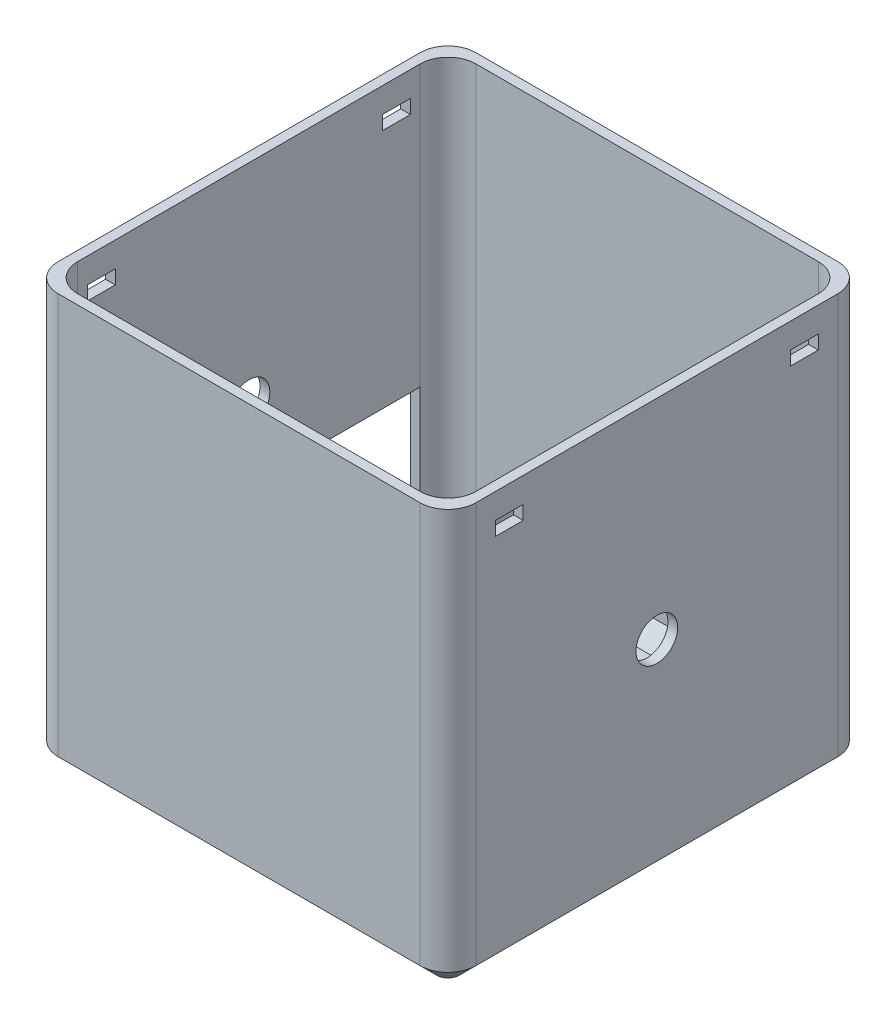
from build123d import *

# Parameters (mm, degrees)
SKETCH1_W           = 150
SKETCH1_H           = 150
BOSS_EXTRUDE1_DEPTH = 150
SHELL1_T            = -3.5
FILLET2_R           = 10
FILLET3_R           = 10
SKETCH2_R           = 7.5
CUT_EXTRUDE1_DEPTH  = 200
CHAMFER1_SIZE       = 6
CHAMFER2_SIZE       = 6
SKETCH3_W           = 10
SKETCH3_H           = 5
CUT_EXTRUDE2_DEPTH  = 234
SKETCH4_W           = 10
SKETCH4_H           = 5
CUT_EXTRUDE3_DEPTH  = 234
SKETCH5_W           = 40
SKETCH5_H           = 40
CUT_EXTRUDE4_DEPTH  = 10
SKETCH6_W           = 4
SKETCH6_H           = 45
BOSS_EXTRUDE2_DEPTH = 40
FILLET4_R           = 10
SKETCH7_W           = 40
SKETCH7_H           = 40
CUT_EXTRUDE5_DEPTH  = 40


with BuildPart() as part:
    # Sketch1 → Boss-Extrude1 (new body)
    with BuildSketch(Plane(origin=(0, 0, 0), x_dir=(1, 0, 0), z_dir=(0, 1, 0))):
        with Locations((75, 75)):
            Rectangle(SKETCH1_W, SKETCH1_H)
    extrude(amount=BOSS_EXTRUDE1_DEPTH)

    # Shell1
    shell1_openings = [part.faces().sort_by_distance(p)[0] for p in [
        (75, 150, -75),
    ]]
    offset(amount=SHELL1_T, openings=shell1_openings, kind=Kind.INTERSECTION)

    # Fillet2
    fillet2_edges = [part.edges().sort_by_distance(p)[0] for p in [
        (150, 75, -150),
        (150, 75, 0),
        (0, 75, 0),
    ]]
    fillet(fillet2_edges, radius=FILLET2_R)

    # Fillet3
    fillet3_edges = [part.edges().sort_by_distance(p)[0] for p in [
        (3.5, 76.75, -146.5),
        (3.5, 76.75, -3.5),
        (146.5, 76.75, -3.5),
        (146.5, 76.75, -146.5),
        (0, 75, -150),
    ]]
    fillet(fillet3_edges, radius=FILLET3_R)

    # Sketch2 → Cut-Extrude1 (cut)
    with BuildSketch(Plane(origin=(150, 0, 0), x_dir=(0, 0, -1), z_dir=(1, 0, 0))):
        with Locations((75, 75)):
            Circle(SKETCH2_R)
    extrude(amount=-CUT_EXTRUDE1_DEPTH, mode=Mode.SUBTRACT)

    # Chamfer1
    chamfer1_edges = [part.edges().sort_by_distance(p)[0] for p in [
        (75, 0, -150),
        (150, 0, -75),
        (75, 0, 0),
        (2.928932188, 0, -2.928932188),
        (147.071067812, 0, -2.928932188),
        (147.071067812, 0, -147.071067812),
        (0, 0, -75),
        (2.928932188, 0, -147.071067812),
    ]]
    chamfer(chamfer1_edges, length=CHAMFER1_SIZE)

    # Chamfer2
    chamfer2_edges = [part.edges().sort_by_distance(p)[0] for p in [
        (3.5, 3.5, -75),
        (75, 3.5, -3.5),
        (146.5, 3.5, -75),
        (75, 3.5, -146.5),
        (6.428932188, 3.5, -143.571067812),
        (143.571067812, 3.5, -143.571067812),
        (143.571067812, 3.5, -6.428932188),
        (6.428932188, 3.5, -6.428932188),
    ]]
    chamfer(chamfer2_edges, length=CHAMFER2_SIZE)

    # Sketch3 → Cut-Extrude2 (cut)
    with BuildSketch(Plane.ZY):
        with Locations((-128, 138.5)):
            Rectangle(SKETCH3_W, SKETCH3_H)
    extrude(amount=-CUT_EXTRUDE2_DEPTH, mode=Mode.SUBTRACT)

    # Sketch4 → Cut-Extrude3 (cut)
    with BuildSketch(Plane.ZY):
        with Locations((-22, 138.5)):
            Rectangle(SKETCH4_W, SKETCH4_H)
    extrude(amount=-CUT_EXTRUDE3_DEPTH, mode=Mode.SUBTRACT)

    # Sketch5 → Cut-Extrude4 (cut)
    with BuildSketch(Plane(origin=(0, 3.5, 0), x_dir=(1, 0, 0), z_dir=(0, 1, 0))):
        with Locations((120.5, 120.5)):
            Rectangle(SKETCH5_W, SKETCH5_H)
    extrude(amount=-CUT_EXTRUDE4_DEPTH, mode=Mode.SUBTRACT)

    # Sketch6 → Boss-Extrude2 (add)
    with BuildSketch(Plane(origin=(0, 3.5, 0), x_dir=(1, 0, 0), z_dir=(0, 1, 0))):
        with Locations((46.5, 124)):
            Rectangle(SKETCH6_W, SKETCH6_H)
    extrude(amount=BOSS_EXTRUDE2_DEPTH)

    # Fillet4
    # the kernel refuses this fillet: 10 mm, written as the material it adds along each edge
    with BuildSketch(Plane(origin=(48.5, -15.5, -146.5), x_dir=(1, 0, 0), z_dir=(0, 1, 0))) as fillet4_piece_1_section:
        with BuildLine():
            CenterArc((FILLET4_R, -FILLET4_R), FILLET4_R, 90, 90)
            Line((0, -FILLET4_R), (0, 0))
            Line((0, 0), (FILLET4_R, 0))
        make_face()
    fillet4_piece_1 = extrude(amount=59, mode=Mode.PRIVATE)
    fillet4_piece_1 = split(fillet4_piece_1, bisect_by=Plane(origin=(50.679406429, 12.771443898, -156.771443898), z_dir=(0, 0.7071067811865476, 0.7071067811865476)), keep=Keep.TOP, mode=Mode.PRIVATE)
    fillet4_piece_1 = split(fillet4_piece_1, bisect_by=Plane(origin=(50.679406429, 0, -144.176636194), z_dir=(0, 1, 0)), keep=Keep.TOP, mode=Mode.PRIVATE)
    add(fillet4_piece_1)
    with BuildSketch(Plane(origin=(48.5, 3.5, -101.5), x_dir=(1, 0, 0), z_dir=(0, 0, -1))) as fillet4_piece_2_section:
        with BuildLine():
            CenterArc((FILLET4_R, -FILLET4_R), FILLET4_R, 90, 90)
            Line((0, -FILLET4_R), (0, 0))
            Line((0, 0), (FILLET4_R, 0))
        make_face()
    fillet4_piece_2 = extrude(amount=64, mode=Mode.PRIVATE)
    fillet4_piece_2 = split(fillet4_piece_2, bisect_by=Plane(origin=(50.685995649, 5.81247532, -146.5), z_dir=(0, 0, 1)), keep=Keep.TOP, mode=Mode.PRIVATE)
    add(fillet4_piece_2)

    # Sketch7 → Cut-Extrude5 (cut)
    with BuildSketch(Plane(origin=(3.5, 0, 0), x_dir=(0, 0, -1), z_dir=(1, 0, 0))):
        with Locations((116.5, 29.5)):
            Rectangle(SKETCH7_W, SKETCH7_H)
    extrude(amount=-CUT_EXTRUDE5_DEPTH, mode=Mode.SUBTRACT)


solid = part.part
